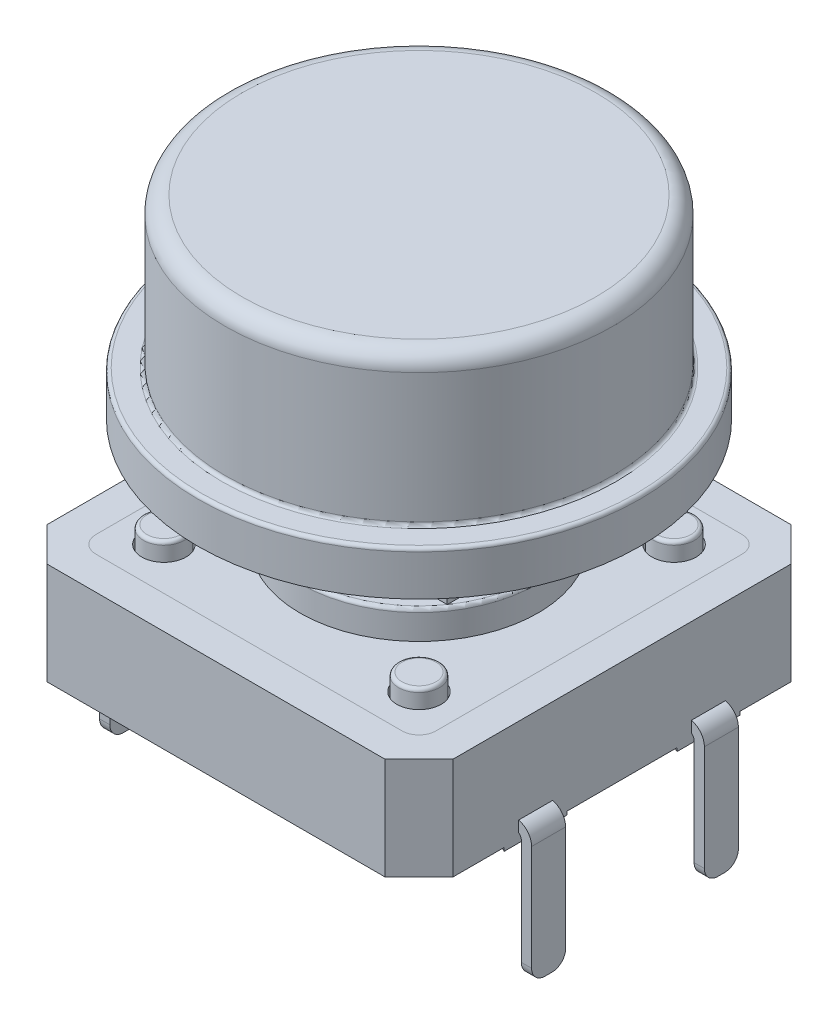
from build123d import *

# Parameters (mm, degrees)
SKETCH1_W            = 11.94
SKETCH1_H            = 11.94
BOSS_EXTRUDE1_DEPTH  = 3
SKETCH2_W            = 10
SKETCH2_H            = 10
CUT_EXTRUDE1_DEPTH   = 0.5
FILLET1_R            = 0.5
CHAMFER1_SIZE        = 1
BOSS_EXTRUDE2_DEPTH  = 0.5
SKETCH4_R            = 3.5
SKETCH4_R_2          = 0.65
CUT_EXTRUDE2_DEPTH   = 0.5
SKETCH5_R            = 0.6
BOSS_EXTRUDE3_DEPTH  = 1
SKETCH6_R            = 3.45
BOSS_EXTRUDE4_DEPTH  = 1.3
SKETCH7_W            = 2.7
SKETCH7_H            = 2.7
BOSS_EXTRUDE5_DEPTH  = 1.3
BOSS_EXTRUDE6_DEPTH  = 2.1
SKETCH9_R            = 1
CUT_EXTRUDE3_DEPTH   = 1.5
SKETCH11_R           = 5
CUT_EXTRUDE4_DEPTH   = 4
SKETCH12_W           = 1.2
SKETCH12_H           = 3.84
BOSS_EXTRUDE7_DEPTH  = 6.4
SKETCH13_W           = 0.5
SKETCH13_H           = 5.2
CUT_EXTRUDE5_DEPTH   = 3.84
FILLET2_R            = 0.5
FILLET3_R            = 0.6
FILLET4_R            = 0.1
SKETCH14_W           = 2
SKETCH14_H           = 0.82
BOSS_EXTRUDE8_DEPTH  = 5.36
FILLET5_R            = 0.1
SKETCH15_W           = 0.6
SKETCH15_H           = 2.5
SKETCH15_W_2         = 2.5
SKETCH15_H_2         = 0.6
BOSS_EXTRUDE9_DEPTH  = 4
BOSS_EXTRUDE10_DEPTH = 0.5
BOSS_EXTRUDE12_DEPTH = 0.1
CUT_EXTRUDE6_DEPTH   = 0.1
FILLET6_R            = 0.4
FILLET7_R            = 0.4


with BuildPart() as part:
    # Sketch1 → Boss-Extrude1 (new body)
    with BuildSketch(Plane(origin=(0, 0, 0), x_dir=(1, 0, 0), z_dir=(0, 1, 0))):
        Rectangle(SKETCH1_W, SKETCH1_H)
    extrude(amount=-BOSS_EXTRUDE1_DEPTH)

    # Sketch2 → Cut-Extrude1 (cut)
    with BuildSketch(Plane(origin=(0, 0, 0), x_dir=(1, 0, 0), z_dir=(0, 1, 0))):
        Rectangle(SKETCH2_W, SKETCH2_H)
    extrude(amount=-CUT_EXTRUDE1_DEPTH, mode=Mode.SUBTRACT)

    # Fillet1
    fillet1_edges = [part.edges().sort_by_distance(p)[0] for p in [
        (5, -0.25, -5),
        (5, -0.25, 5),
        (-5, -0.25, 5),
        (-5, -0.25, -5),
    ]]
    fillet(fillet1_edges, radius=FILLET1_R)

    # Chamfer1
    chamfer1_edges = [part.edges().sort_by_distance(p)[0] for p in [
        (-5.97, -1.5, -5.97),
        (5.97, -1.5, -5.97),
        (5.97, -1.5, 5.97),
        (-5.97, -1.5, 5.97),
    ]]
    chamfer(chamfer1_edges, length=CHAMFER1_SIZE)

    # Sketch5 → Boss-Extrude3 (add)
    with BuildSketch(Plane(origin=(0, -0.5, 0), x_dir=(1, 0, 0), z_dir=(0, 1, 0))):
        with Locations(Location((-3.75, 3.75, 0), (0, 0, 270))):
            Circle(SKETCH5_R)
        with Locations(Location((3.75, 3.75, 0), (0, 0, 270))):
            Circle(SKETCH5_R)
        with Locations(Location((3.75, -3.75, 0), (0, 0, 270))):
            Circle(SKETCH5_R)
        with Locations(Location((-3.75, -3.75, 0), (0, 0, 270))):
            Circle(SKETCH5_R)
    extrude(amount=BOSS_EXTRUDE3_DEPTH)

    # Sketch6 → Boss-Extrude4 (add)
    with BuildSketch(Plane(origin=(0, -0.5, 0), x_dir=(1, 0, 0), z_dir=(0, 1, 0))):
        with Locations(Location((0, 0, 0), (0, 0, 270))):
            Circle(SKETCH6_R)
    extrude(amount=BOSS_EXTRUDE4_DEPTH)

    # Sketch7 → Boss-Extrude5 (add)
    with BuildSketch(Plane(origin=(0, 0.8, 0), x_dir=(1, 0, 0), z_dir=(0, 1, 0))):
        Rectangle(SKETCH7_W, SKETCH7_H)
    extrude(amount=BOSS_EXTRUDE5_DEPTH)

    # Sketch8 → Boss-Extrude6 (add)
    with BuildSketch(Plane(origin=(0, 2.1, 0), x_dir=(1, 0, 0), z_dir=(0, 1, 0))):
        with BuildLine():
            Line((-1.725, 1.925), (1.725, 1.925))
            ThreePointArc((1.725, 1.925), (1.866421356, 1.866421356), (1.925, 1.725))
            Line((1.925, 1.725), (1.925, -1.725))
            ThreePointArc((1.925, -1.725), (1.866421356, -1.866421356), (1.725, -1.925))
            Line((1.725, -1.925), (-1.725, -1.925))
            ThreePointArc((-1.725, -1.925), (-1.866421356, -1.866421356), (-1.925, -1.725))
            Line((-1.925, -1.725), (-1.925, 1.725))
            ThreePointArc((-1.925, 1.725), (-1.866421356, 1.866421356), (-1.725, 1.925))
        make_face()
    extrude(amount=BOSS_EXTRUDE6_DEPTH)

    # Sketch9 → Cut-Extrude3 (cut)
    with BuildSketch(Plane(origin=(0, 4.2, 0), x_dir=(1, 0, 0), z_dir=(0, 1, 0))):
        with Locations(Location((0, 0, 0), (0, 0, 270))):
            Circle(SKETCH9_R)
    extrude(amount=-CUT_EXTRUDE3_DEPTH, mode=Mode.SUBTRACT)

    # Fillet4
    fillet4_edges = [part.edges().sort_by_distance(p)[0] for p in [
        (-3.75, 0.5, -4.35),
        (3.75, 0.5, -4.35),
        (3.75, 0.5, 3.15),
        (-3.75, 0.5, 3.15),
        (0, 0.8, -3.45),
    ]]
    fillet(fillet4_edges, radius=FILLET4_R)

    # Sketch18 → Boss-Extrude12 (add)
    with BuildSketch(Plane.XZ.offset(3)):
        with BuildLine():
            Line((-5.97, -3.464986486), (-5.97, -1.615013514))
            ThreePointArc((-5.97, -1.615013514), (-5.35, -2.54), (-5.97, -3.464986486))
        make_face()
        with BuildLine():
            Line((5.97, 3.464986486), (5.97, 1.615013514))
            ThreePointArc((5.97, 1.615013514), (5.35, 2.54), (5.97, 3.464986486))
        make_face()
        with BuildLine():
            Line((5.97, -1.615013514), (5.97, -3.464986486))
            ThreePointArc((5.97, -3.464986486), (5.35, -2.54), (5.97, -1.615013514))
        make_face()
        with BuildLine():
            Line((-5.97, 1.615013514), (-5.97, 3.464986486))
            ThreePointArc((-5.97, 3.464986486), (-5.35, 2.54), (-5.97, 1.615013514))
        make_face()
        with BuildLine():
            Line((-3, 5), (3, 5))
            ThreePointArc((3, 5), (4.414213562, 4.414213562), (5, 3))
            Line((5, 3), (5, -3))
            ThreePointArc((5, -3), (4.414213562, -4.414213562), (3, -5))
            Line((3, -5), (-3, -5))
            ThreePointArc((-3, -5), (-4.414213562, -4.414213562), (-5, -3))
            Line((-5, -3), (-5, 3))
            ThreePointArc((-5, 3), (-4.414213562, 4.414213562), (-3, 5))
        make_face()
    extrude(amount=BOSS_EXTRUDE12_DEPTH)

    # Sketch19 → Cut-Extrude6 (cut)
    with BuildSketch(Plane.XZ.offset(3.1)):
        Polygon((-3, 5), (-3, 3), (-5, 3), (-5, -3), (-3, -3), (-3, -5), (3, -5), (3, -3), (5, -3), (5, 3), (3, 3), (3, 5), align=None)
    extrude(amount=-CUT_EXTRUDE6_DEPTH, mode=Mode.SUBTRACT)


with BuildPart() as body_2:
    # Sketch3 → Boss-Extrude2 (new body)
    with BuildSketch(Plane(origin=(0, -0.5, 0), x_dir=(1, 0, 0), z_dir=(0, 1, 0))):
        with BuildLine():
            Line((-5, 4.5), (-5, -4.5))
            ThreePointArc((-5, -4.5), (-4.853553391, -4.853553391), (-4.5, -5))
            Line((-4.5, -5), (4.5, -5))
            ThreePointArc((4.5, -5), (4.853553391, -4.853553391), (5, -4.5))
            Line((5, -4.5), (5, 4.5))
            ThreePointArc((5, 4.5), (4.853553391, 4.853553391), (4.5, 5))
            Line((4.5, 5), (-4.5, 5))
            ThreePointArc((-4.5, 5), (-4.853553391, 4.853553391), (-5, 4.5))
        make_face()
    extrude(amount=BOSS_EXTRUDE2_DEPTH)

    # Sketch4 → Cut-Extrude2 (cut)
    with BuildSketch(Plane(origin=(0, 0, 0), x_dir=(1, 0, 0), z_dir=(0, 1, 0))):
        with Locations(Location((0, 0, 0), (0, 0, 270))):
            Circle(SKETCH4_R)
        with Locations(Location((-3.75, 3.75, 0), (0, 0, 270))):
            Circle(SKETCH4_R_2)
        with Locations(Location((3.75, 3.75, 0), (0, 0, 270))):
            Circle(SKETCH4_R_2)
        with Locations(Location((3.75, -3.75, 0), (0, 0, 270))):
            Circle(SKETCH4_R_2)
        with Locations(Location((-3.75, -3.75, 0), (0, 0, 270))):
            Circle(SKETCH4_R_2)
    extrude(amount=-CUT_EXTRUDE2_DEPTH, mode=Mode.SUBTRACT)


with BuildPart() as body_3:
    # Sketch10 → Revolve1 (revolve)
    with BuildSketch(Plane(origin=(0, 0, 0), x_dir=(0, 0, -1), z_dir=(1, 0, 0))):
        with BuildLine():
            Line((0, 3.2), (-6.5, 3.2))
            Line((-6.5, 3.2), (-6.5, 4.4))
            ThreePointArc((-6.5, 4.4), (-6.470710678, 4.470710678), (-6.4, 4.5))
            Line((-6.4, 4.5), (-5.7, 4.5))
            Line((-5.7, 4.5), (-5.7, 8.4))
            ThreePointArc((-5.7, 8.4), (-5.553553391, 8.753553391), (-5.2, 8.9))
            Line((-5.2, 8.9), (0, 8.9))
            Line((0, 8.9), (0, 3.2))
        make_face()
    revolve(axis=Axis((0, 8.9, 0), (0, -1, 0)))

    # Sketch11 → Cut-Extrude4 (cut)
    with BuildSketch(Plane.XZ.offset(-3.2)):
        with Locations(Location((0, 0, 0), (0, 0, 270))):
            Circle(SKETCH11_R)
    extrude(amount=-CUT_EXTRUDE4_DEPTH, mode=Mode.SUBTRACT)

    # Sketch12 → Boss-Extrude7 (add)
    with BuildSketch(Plane.XZ.offset(-7.2)):
        with Locations((2.15, 0)):
            Rectangle(SKETCH12_W, SKETCH12_H)
        with Locations((-2.15, 0)):
            Rectangle(SKETCH12_W, SKETCH12_H)
    extrude(amount=BOSS_EXTRUDE7_DEPTH)

    # Sketch13 → Cut-Extrude5 (cut)
    with BuildSketch(Plane.XY.offset(1.92)):
        with Locations((-1.8, 4.6)):
            Rectangle(SKETCH13_W, SKETCH13_H)
        with Locations((1.8, 4.6)):
            Rectangle(SKETCH13_W, SKETCH13_H)
    extrude(amount=-CUT_EXTRUDE5_DEPTH, mode=Mode.SUBTRACT)

    # Fillet2
    fillet2_edges = [body_3.edges().sort_by_distance(p)[0] for p in [
        (1.55, 0.8, 0),
        (-1.55, 0.8, 0),
    ]]
    fillet(fillet2_edges, radius=FILLET2_R)

    # Fillet3
    # the kernel refuses this fillet: 0.6 mm, written as the material it takes off along each edge
    with BuildSketch(Plane(origin=(1.55, 2, 3.399019946), x_dir=(0, -1, 0), z_dir=(0, 0, -1))) as fillet3_piece_1:
        with BuildLine():
            CenterArc((0.591607978, -0.6), FILLET3_R, 90, 80.405931773)
            Line((0, -0.5), (-0.01183216, -0.498))
            ThreePointArc((-0.01183216, -0.498), (-0.012, -0.25), (-0.012, 0))
            Line((-0.012, 0), (0, 0.012))
            Line((0, 0.012), (0.591607978, 0.012))
            Line((0.591607978, 0.012), (0.591607978, 0))
        make_face()
    extrude(amount=6.798039892, mode=Mode.SUBTRACT)
    with BuildSketch(Plane(origin=(-1.55, 2, 3.399019946), x_dir=(0, -1, 0), z_dir=(0, 0, -1))) as fillet3_piece_2:
        with BuildLine():
            CenterArc((0.591607978, 0.6), FILLET3_R, 189.594068227, 80.405931773)
            Line((0, 0.5), (-0.01183216, 0.498))
            ThreePointArc((-0.01183216, 0.498), (-0.012, 0.25), (-0.012, 0))
            Line((-0.012, 0), (0, -0.012))
            Line((0, -0.012), (0.591607978, -0.012))
            Line((0.591607978, -0.012), (0.591607978, 0))
        make_face()
    extrude(amount=6.798039892, mode=Mode.SUBTRACT)

    # Sketch14 → Boss-Extrude8 (add)
    with BuildSketch(Plane.XZ.offset(-7.2)):
        with Locations((0, 2.34)):
            Rectangle(SKETCH14_W, SKETCH14_H)
        with Locations((0, -2.34)):
            Rectangle(SKETCH14_W, SKETCH14_H)
    extrude(amount=BOSS_EXTRUDE8_DEPTH)

    # Fillet5
    fillet5_edges = [body_3.edges().sort_by_distance(p)[0] for p in [
        (0, 4.5, -5.7),
    ]]
    fillet(fillet5_edges, radius=FILLET5_R)

    # Sketch15 → Boss-Extrude9 (add)
    with BuildSketch(Plane.XZ.offset(-7.2)):
        with Locations((0, 4)):
            Rectangle(SKETCH15_W, SKETCH15_H)
        with Locations((0, -4)):
            Rectangle(SKETCH15_W, SKETCH15_H)
        with Locations((4, 0)):
            Rectangle(SKETCH15_W_2, SKETCH15_H_2)
        with Locations((-4, 0)):
            Rectangle(SKETCH15_W_2, SKETCH15_H_2)
    extrude(amount=BOSS_EXTRUDE9_DEPTH)


with BuildPart() as body_4:
    # Sketch16 → Boss-Extrude10 (new, symmetric)
    with BuildSketch(Plane.XY.offset(2.54)):
        with BuildLine():
            Line((-5.85, -2.5), (5.85, -2.5))
            ThreePointArc((5.85, -2.5), (6.203553391, -2.646446609), (6.35, -3))
            Line((6.35, -3), (6.35, -6.5))
            Line((6.35, -6.5), (6.05, -6.5))
            Line((6.05, -6.5), (6.05, -3))
            ThreePointArc((6.05, -3), (5.991421356, -2.858578644), (5.85, -2.8))
            Line((5.85, -2.8), (-5.85, -2.8))
            ThreePointArc((-5.85, -2.8), (-5.991421356, -2.858578644), (-6.05, -3))
            Line((-6.05, -3), (-6.05, -6.5))
            Line((-6.05, -6.5), (-6.35, -6.5))
            Line((-6.35, -6.5), (-6.35, -3))
            ThreePointArc((-6.35, -3), (-6.203553391, -2.646446609), (-5.85, -2.5))
        make_face()
    extrude(amount=BOSS_EXTRUDE10_DEPTH, both=True)


with BuildPart() as body_5:
    # Mirror1: mirrored copy
    add(body_4.part.mirror(Plane.XY))

    # Fillet7
    fillet7_edges = [body_5.edges().sort_by_distance(p)[0] for p in [
        (-6.2, -6.5, -3.04),
        (6.2, -6.5, -2.04),
        (-6.2, -6.5, -2.04),
        (6.2, -6.5, -3.04),
    ]]
    fillet(fillet7_edges, radius=FILLET7_R)


with BuildPart() as body_4_1:
    add(body_4.part)

    # Fillet6
    fillet6_edges = [body_4_1.edges().sort_by_distance(p)[0] for p in [
        (-6.2, -6.5, 3.04),
        (6.2, -6.5, 2.04),
        (-6.2, -6.5, 2.04),
        (6.2, -6.5, 3.04),
    ]]
    fillet(fillet6_edges, radius=FILLET6_R)


solid = Compound([part.part, body_2.part, body_3.part, body_5.part, body_4_1.part])
